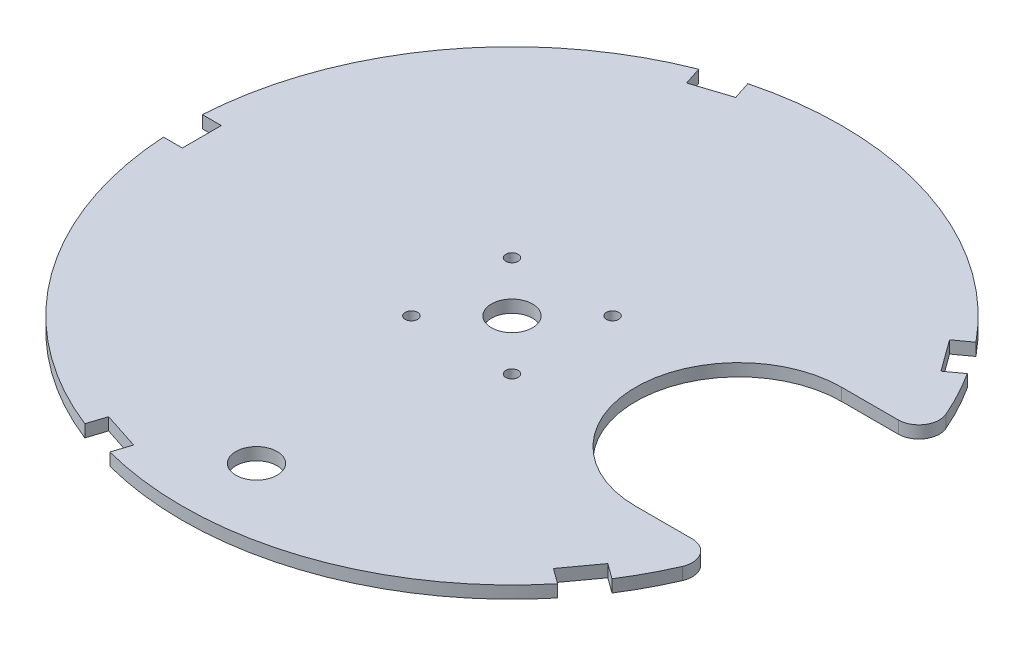
from build123d import *

# Parameters (mm, degrees)
SKETCH1_R           = 6.35
SKETCH1_R_2         = 1.905
BOSS_EXTRUDE1_DEPTH = 3.81
FILLET1_R           = 6.35


with BuildPart() as part:
    # Sketch1 → Boss-Extrude1 (new body)
    with BuildSketch(Plane(origin=(0, 0, 0), x_dir=(1, 0, 0), z_dir=(0, 1, 0))):
        with BuildLine():
            ThreePointArc((69.85, -31.75), (38.1, 0), (69.85, 31.75))
            Line((69.85, 31.75), (96.511644375, 31.75))
            ThreePointArc((96.511644375, 31.75), (91.769592582, 43.599333451), (85.579383175, 54.760653532))
            Line((85.579383175, 54.760653532), (80.868736176, 51.338168153))
            Line((80.868736176, 51.338168153), (73.815313148, 61.046372085))
            Line((73.815313148, 61.046372085), (78.525960148, 64.468857465))
            ThreePointArc((78.525960148, 64.468857465), (31.396126628, 96.627342056), (-25.634992609, 98.312802594))
            Line((-25.634992609, 98.312802594), (-23.835685564, 92.775104924))
            Line((-23.835685564, 92.775104924), (-35.24836376, 89.066900992))
            Line((-35.24836376, 89.066900992), (-37.047670805, 94.604598662))
            ThreePointArc((-37.047670805, 94.604598662), (-82.196126628, 59.718981633), (-101.422679909, 6))
            Line((-101.422679909, 6), (-95.6, 6))
            Line((-95.6, 6), (-95.6, -6))
            Line((-95.6, -6), (-101.422679909, -6))
            ThreePointArc((-101.422679909, -6), (-82.196126628, -59.718981633), (-37.047670805, -94.604598662))
            Line((-37.047670805, -94.604598662), (-35.24836376, -89.066900992))
            Line((-35.24836376, -89.066900992), (-23.835685564, -92.775104924))
            Line((-23.835685564, -92.775104924), (-25.634992609, -98.312802594))
            ThreePointArc((-25.634992609, -98.312802594), (31.396126628, -96.627342056), (78.525960148, -64.468857465))
            Line((78.525960148, -64.468857465), (73.815313148, -61.046372085))
            Line((73.815313148, -61.046372085), (80.868736176, -51.338168153))
            Line((80.868736176, -51.338168153), (85.579383175, -54.760653532))
            ThreePointArc((85.579383175, -54.760653532), (91.769592582, -43.599333451), (96.511644375, -31.75))
            Line((96.511644375, -31.75), (69.85, -31.75))
        make_face()
        with Locations((0, -78.74)):
            Circle(SKETCH1_R, mode=Mode.SUBTRACT)
        with Locations((-15.499999988, -15.499999988)):
            Circle(SKETCH1_R_2, mode=Mode.SUBTRACT)
        Circle(SKETCH1_R, mode=Mode.SUBTRACT)
        with Locations((15.499999988, -15.499999988)):
            Circle(SKETCH1_R_2, mode=Mode.SUBTRACT)
        with Locations((-15.499999988, 15.499999988)):
            Circle(SKETCH1_R_2, mode=Mode.SUBTRACT)
        with Locations((15.499999988, 15.499999988)):
            Circle(SKETCH1_R_2, mode=Mode.SUBTRACT)
    extrude(amount=BOSS_EXTRUDE1_DEPTH)

    # Fillet1
    fillet1_edges = [part.edges().sort_by_distance(p)[0] for p in [
        (96.511644375, 1.905, 31.75),
        (96.511644375, 1.905, -31.75),
    ]]
    fillet(fillet1_edges, radius=FILLET1_R)


solid = part.part
